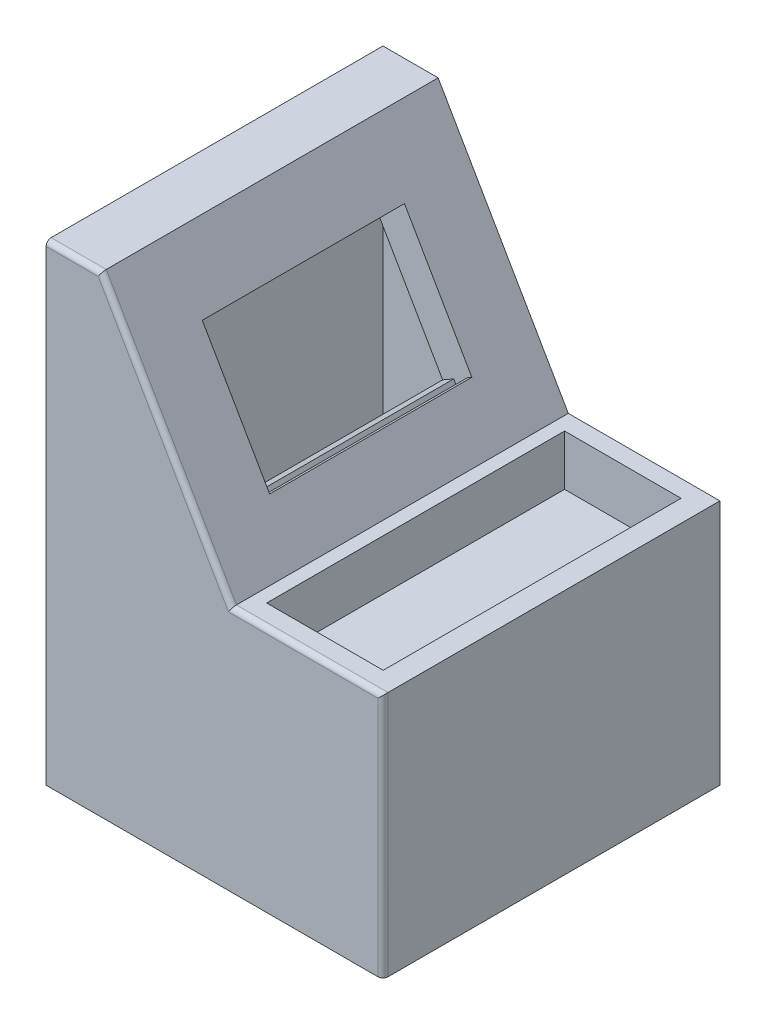
from build123d import *

# Parameters (mm, degrees)
BOSS_EXTRUDE1_DEPTH            = 508
SKETCH2_W                      = 175.72130466
SKETCH2_H                      = 449.160798253
CUT_EXTRUDE1_DEPTH             = 76.2
SKETCH3_W                      = 304.8
SKETCH3_H                      = 203.2
CUT_EXTRUDE3_DEPTH             = 50.8
SHELL2_START                   = 27.94
SHELL2_DEPTH                   = 452.12
SHELL2_2_DEPTH                 = 45.72
SHELL2_START_2                 = 434.34
SHELL2_3_DEPTH                 = 45.72
FILLET1_R                      = 7.62
CUT_EXTRUDE4_REACH             = 965.862
CUT_EXTRUDE4_DIRECTION_2_DEPTH = 97.536


# Read off the part's stored shape, not the designer's step: Shell2
with BuildPart() as part:
    # Sketch1 → Boss-Extrude1 (new body)
    with BuildSketch(Plane.XY):
        Polygon((508, 0), (508, 371.248348728), (279.4, 371.248348728), (83.128822626, 711.2), (0, 711.2), (0, 0), align=None)
    extrude(amount=BOSS_EXTRUDE1_DEPTH)

    # Sketch2 → Cut-Extrude1 (cut)
    with BuildSketch(Plane(origin=(0, 371.248348728, 0), x_dir=(1, 0, 0), z_dir=(0, 1, 0))):
        with Locations((387.505332687, -250.48614125)):
            Rectangle(SKETCH2_W, SKETCH2_H)
    extrude(amount=-CUT_EXTRUDE1_DEPTH, mode=Mode.SUBTRACT)

    # Sketch3 → Cut-Extrude3 (cut)
    with BuildSketch(Plane(origin=(370.305250556, 213.795836091, 0), x_dir=(0, 0, -1), z_dir=(0.8660254037844397, 0.49999999999999806, 0))):
        with Locations((-254, 371.152855858)):
            Rectangle(SKETCH3_W, SKETCH3_H)
    extrude(amount=-CUT_EXTRUDE3_DEPTH, mode=Mode.SUBTRACT)

    # Shell2 outline → Shell2 (cut)
    with BuildSketch(Plane.XY.offset(SHELL2_START)):
        Polygon((27.94, 27.94), (480.06, 27.94), (480.06, 267.108348728), (271.704680357, 267.108348728), (271.704680357, 343.308348728), (263.268833479, 343.308348728), (225.302072845, 409.068707145), (205.504732114, 397.638707145), (191.534732114, 421.835456927), (89.934732114, 597.811818976), (75.964732114, 622.008568757), (95.762072845, 633.438568757), (66.997656105, 683.26), (27.94, 683.26), align=None)
    extrude(amount=SHELL2_DEPTH, mode=Mode.SUBTRACT)

    # Shell2 2 outline → Shell2 2 (cut)
    with BuildSketch(Plane.XY.offset(SHELL2_START)):
        Polygon((225.302072845, 409.068707145), (95.762072845, 633.438568757), (75.964732114, 622.008568757), (89.934732114, 597.811818976), (191.534732114, 421.835456927), (205.504732114, 397.638707145), align=None)
    extrude(amount=SHELL2_2_DEPTH, mode=Mode.SUBTRACT)

    # Shell2 3 outline → Shell2 3 (cut)
    with BuildSketch(Plane.XY.offset(SHELL2_START_2)):
        Polygon((225.302072845, 409.068707145), (95.762072845, 633.438568757), (75.964732114, 622.008568757), (89.934732114, 597.811818976), (191.534732114, 421.835456927), (205.504732114, 397.638707145), align=None)
    extrude(amount=SHELL2_3_DEPTH, mode=Mode.SUBTRACT)

    # Fillet1
    fillet1_edges = [part.edges().sort_by_distance(p)[0] for p in [
        (393.7, 371.248348728, 508),
        (181.264411313, 541.224174364, 508),
        (41.564411313, 711.2, 508),
        (508, 185.624174364, 508),
    ]]
    fillet(fillet1_edges, radius=FILLET1_R)

    # Cut-Extrude4: up to this face of the body (flat: up to its plane)
    cut_extrude4_end = Plane(part.part.faces().sort_by_distance((162.73177737, 522.523637951, 101.6))[0])
    # Sketch6 → Cut-Extrude4 (cut, up to the picked face)
    with BuildSketch(Plane(origin=(0, 0, 406.4), x_dir=(-1, 0, 0), z_dir=(0, 0, -1)), mode=Mode.PRIVATE) as cut_extrude4_sk1:
        Polygon((-109.711824261, 652.442307464), (-240.02087993, 424.214985446), (-218.44952186, 411.898566558), (-97.827125151, 645.656599669), align=None)
    cut_extrude4_tool1 = split(extrude(cut_extrude4_sk1.sketch, amount=CUT_EXTRUDE4_REACH, mode=Mode.PRIVATE), bisect_by=cut_extrude4_end, keep=Keep.BOTH, mode=Mode.PRIVATE)
    add(cut_extrude4_tool1.solids().sort_by(Axis((172.556766, 522.406417, 406.4), (0, 0, -1)))[0], mode=Mode.SUBTRACT)

    # Sketch6 → Cut-Extrude4 direction 2 (cut)
    with BuildSketch(Plane(origin=(0, 0, 406.4), x_dir=(-1, 0, 0), z_dir=(0, 0, -1))):
        Polygon((-109.711824261, 652.442307464), (-240.02087993, 424.214985446), (-218.44952186, 411.898566558), (-97.827125151, 645.656599669), align=None)
    extrude(amount=-CUT_EXTRUDE4_DIRECTION_2_DEPTH, mode=Mode.SUBTRACT)


solid = part.part
